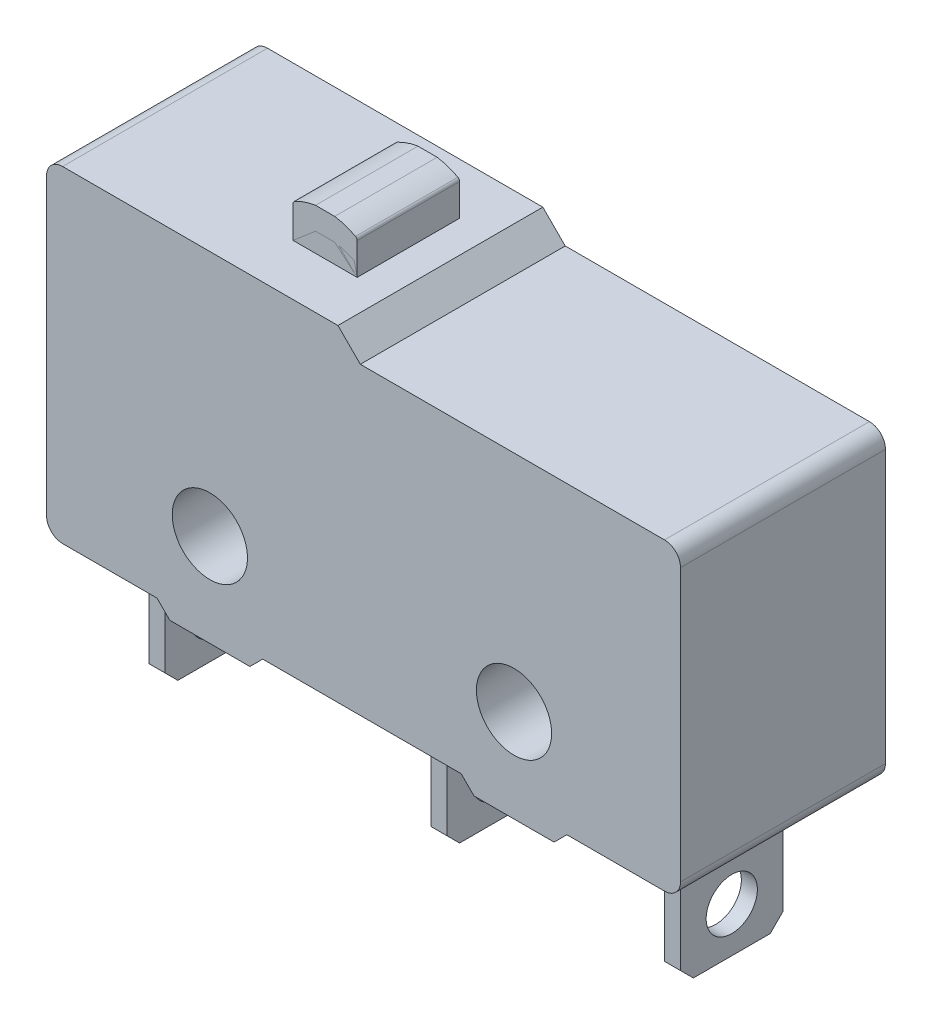
from build123d import *

# Parameters (mm, degrees)
CROQUIS1_R              = 1.175
SALIENTE_EXTRUIR2_DEPTH = 6.4
SALIENTE_EXTRUIR3_START = -1.6
SALIENTE_EXTRUIR3_DEPTH = 3.2
SALIENTE_EXTRUIR4_START = -1.6
SALIENTE_EXTRUIR4_DEPTH = 3.2
REDONDEO1_R             = 0.1
REDONDEO2_R             = 0.1
SALIENTE_EXTRUIR5_DEPTH = 6.4
SALIENTE_EXTRUIR6_START = -1.6
CROQUIS5_R              = 0.8
SALIENTE_EXTRUIR6_DEPTH = 0.5
SALIENTE_EXTRUIR7_START = -17.7
CROQUIS5_2_R            = 0.8
SALIENTE_EXTRUIR7_DEPTH = 0.5
SALIENTE_EXTRUIR8_START = -10.4
CROQUIS5_3_R            = 0.8
SALIENTE_EXTRUIR8_DEPTH = 0.5
REDONDEO3_R             = 0.5


# Read off the part's stored shape, not the designer's step: SS_01_BASE-1-surface1
with BuildPart() as part:
    # Croquis1 → Saliente-Extruir2 (new body)
    with BuildSketch(Plane(origin=(0, 0, -3.2), x_dir=(-1, 0, 0), z_dir=(0, 0, -1))):
        Polygon((14.6, -2.5), (14.6, 7.7), (5.5, 7.7), (4.8, 7), (-5.2, 7), (-5.2, -2.5), align=None)
        Circle(CROQUIS1_R, mode=Mode.SUBTRACT)
        with Locations((9.5, 0)):
            Circle(CROQUIS1_R, mode=Mode.SUBTRACT)
    extrude(amount=-SALIENTE_EXTRUIR2_DEPTH)

    # Croquis2 → Saliente-Extruir3 (add)
    with BuildSketch(Plane.XY.offset(3.2).offset(SALIENTE_EXTRUIR3_START)):
        with BuildLine():
            Line((-8.5, 7.7), (-8.5, 8.054678814))
            ThreePointArc((-8.5, 8.054678814), (-8.161472313, 8.21007453), (-7.8, 8.3))
            Line((-7.8, 8.3), (-7.2, 8.3))
            ThreePointArc((-7.2, 8.3), (-6.838527687, 8.21007453), (-6.5, 8.054678814))
            Line((-6.5, 8.054678814), (-6.5, 7.7))
            Line((-6.5, 7.7), (-8.5, 7.7))
        make_face()
    extrude(amount=-SALIENTE_EXTRUIR3_DEPTH)

    # Redondeo2
    redondeo2_edges = [part.edges().sort_by_distance(p)[0] for p in [
        (-8.5, 8.054678814, 0),
        (-6.5, 8.054678814, 0),
    ]]
    fillet(redondeo2_edges, radius=REDONDEO2_R)

    # Croquis4 → Saliente-Extruir5 (add)
    with BuildSketch(Plane.XY.offset(3.2)):
        Polygon((-11.15, -2.5), (-7.85, -2.5), (-8.25, -2.9), (-10.75, -2.9), align=None)
        Polygon((-1.65, -2.5), (1.65, -2.5), (1.25, -2.9), (-1.25, -2.9), align=None)
    extrude(amount=-SALIENTE_EXTRUIR5_DEPTH)

    # Croquis5 → Saliente-Extruir6 (add)
    with BuildSketch(Plane.ZY.offset(14.6).offset(SALIENTE_EXTRUIR6_START)):
        Polygon((-1.6, -2.5), (-1.6, -6), (-1.2, -6.4), (1.2, -6.4), (1.6, -6), (1.6, -2.5), align=None)
        with Locations((0, -5)):
            Circle(CROQUIS5_R, mode=Mode.SUBTRACT)
    extrude(amount=-SALIENTE_EXTRUIR6_DEPTH)

    # Croquis5<3> → Saliente-Extruir8 (add)
    with BuildSketch(Plane.ZY.offset(14.6).offset(SALIENTE_EXTRUIR8_START)):
        Polygon((-1.6, -2.5), (-1.6, -6), (-1.2, -6.4), (1.2, -6.4), (1.6, -6), (1.6, -2.5), align=None)
        with Locations((0, -5)):
            Circle(CROQUIS5_3_R, mode=Mode.SUBTRACT)
    extrude(amount=-SALIENTE_EXTRUIR8_DEPTH)

    # Redondeo3
    redondeo3_edges = [part.edges().sort_by_distance(p)[0] for p in [
        (-14.6, 7.7, 0),
        (-14.6, -2.5, 0),
        (5.2, -2.5, 0),
        (5.2, 7, 0),
    ]]
    fillet(redondeo3_edges, radius=REDONDEO3_R)


with BuildPart() as body_2:
    # Croquis3 → Saliente-Extruir4 (new body)
    with BuildSketch(Plane.XY.offset(3.2).offset(SALIENTE_EXTRUIR4_START)):
        with BuildLine():
            Line((-8.5, 7.7), (-6.5, 7.7))
            Line((-6.5, 7.7), (-6.5, 8.754678814))
            ThreePointArc((-6.5, 8.754678814), (-6.838527687, 8.91007453), (-7.2, 9))
            Line((-7.2, 9), (-7.8, 9))
            ThreePointArc((-7.8, 9), (-8.161472313, 8.91007453), (-8.5, 8.754678814))
            Line((-8.5, 8.754678814), (-8.5, 7.7))
        make_face()
    extrude(amount=-SALIENTE_EXTRUIR4_DEPTH)

    # Redondeo1
    redondeo1_edges = [body_2.edges().sort_by_distance(p)[0] for p in [
        (-8.5, 8.754678814, 0),
        (-6.5, 8.754678814, 0),
    ]]
    fillet(redondeo1_edges, radius=REDONDEO1_R)


with BuildPart() as body_3:
    # Croquis5<2> → Saliente-Extruir7 (new body)
    with BuildSketch(Plane.ZY.offset(14.6).offset(SALIENTE_EXTRUIR7_START)):
        Polygon((-1.6, -2.5), (-1.6, -6), (-1.2, -6.4), (1.2, -6.4), (1.6, -6), (1.6, -2.5), align=None)
        with Locations((0, -5)):
            Circle(CROQUIS5_2_R, mode=Mode.SUBTRACT)
    extrude(amount=-SALIENTE_EXTRUIR7_DEPTH)


solid = Compound([part.part, body_2.part, body_3.part])
